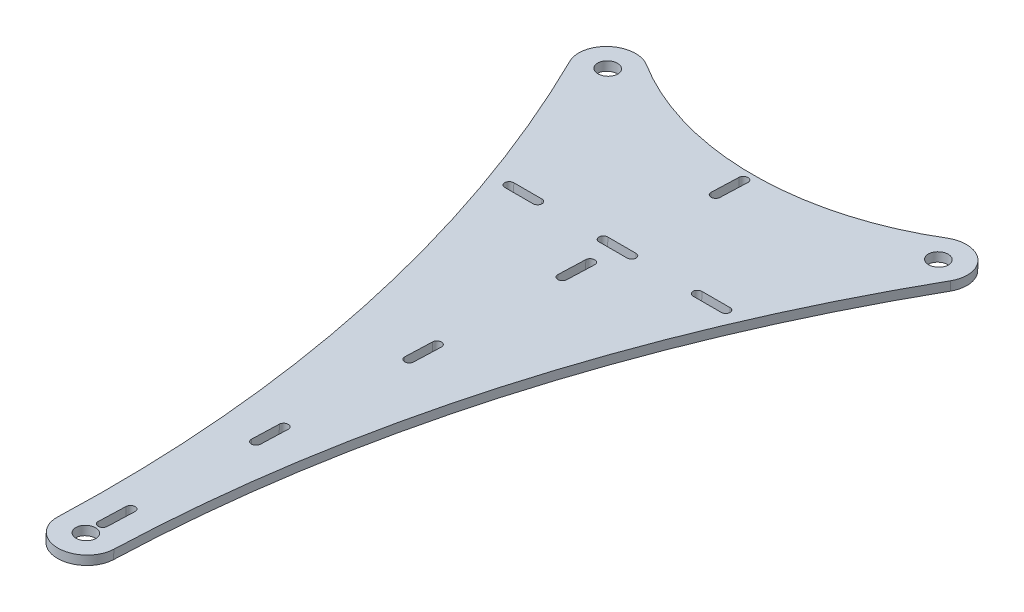
from build123d import *

# Parameters (mm, degrees)
SKETCH1_R           = 3.499999985
SKETCH1_R_2         = 3.5
BOSS_EXTRUDE1_DEPTH = 3.175
CUT_EXTRUDE1_DEPTH  = 3.175


with BuildPart() as part:
    # Sketch1 → Boss-Extrude1 (new body)
    with BuildSketch(Plane(origin=(0, 79.166310833, -2.766864901), x_dir=(0, -0.03492870325036397, -0.9993898066766781), z_dir=(0, -0.9993898066766781, 0.03492870325036397))):
        with BuildLine():
            ThreePointArc((-118.870418158, 10), (-128.870418158, 0), (-118.870418158, -10))
            ThreePointArc((-118.870418158, -10), (4.966133868, -24.680117915), (121.938173717, -67.906722838))
            ThreePointArc((121.938173717, -67.906722838), (133.880607875, -65.730494008), (134.924502551, -53.636363636))
            ThreePointArc((134.924502551, -53.636363636), (119.323202161, 0), (134.924502551, 53.636363636))
            ThreePointArc((134.924502551, 53.636363636), (133.880607875, 65.730494008), (121.938173717, 67.906722838))
            ThreePointArc((121.938173717, 67.906722838), (4.966133868, 24.680117915), (-118.870418158, 10))
        make_face()
        with Locations((-118.870418158, 0)):
            Circle(SKETCH1_R, mode=Mode.SUBTRACT)
        with Locations((126.48463259, 59)):
            Circle(SKETCH1_R_2, mode=Mode.SUBTRACT)
        with Locations((126.48463259, -59)):
            Circle(SKETCH1_R_2, mode=Mode.SUBTRACT)
    extrude(amount=BOSS_EXTRUDE1_DEPTH)

    # Sketch2 → Cut-Extrude1 (cut)
    with BuildSketch(Plane(origin=(0, 75.993248196, -2.655966268), x_dir=(1, 0, 0), z_dir=(0, -0.9993898066766781, 0.034928703250363964))):
        with BuildLine():
            Line((1.5875, 112.870418158), (1.5875, 102.870418158))
            ThreePointArc((1.5875, 102.870418158), (0, 101.282918158), (-1.5875, 102.870418158))
            Line((-1.5875, 102.870418158), (-1.5875, 112.870418158))
            ThreePointArc((-1.5875, 112.870418158), (0, 114.457918158), (1.5875, 112.870418158))
        make_face()
        with BuildLine():
            Line((1.5875, -105.938173717), (1.5875, -115.938173717))
            ThreePointArc((1.5875, -115.938173717), (0, -117.525673717), (-1.5875, -115.938173717))
            Line((-1.5875, -115.938173717), (-1.5875, -105.938173717))
            ThreePointArc((-1.5875, -105.938173717), (0, -104.350673717), (1.5875, -105.938173717))
        make_face()
        with BuildLine():
            Line((1.5875, 58.168270189), (1.5875, 48.168270189))
            ThreePointArc((1.5875, 48.168270189), (0, 46.580770189), (-1.5875, 48.168270189))
            Line((-1.5875, 48.168270189), (-1.5875, 58.168270189))
            ThreePointArc((-1.5875, 58.168270189), (0, 59.755770189), (1.5875, 58.168270189))
        make_face()
        with BuildLine():
            Line((1.5875, 3.46612222), (1.5875, -6.53387778))
            ThreePointArc((1.5875, -6.53387778), (0, -8.12137778), (-1.5875, -6.53387778))
            Line((-1.5875, -6.53387778), (-1.5875, 3.46612222))
            ThreePointArc((-1.5875, 3.46612222), (0, 5.05362222), (1.5875, 3.46612222))
        make_face()
        with BuildLine():
            Line((1.5875, -51.236025749), (1.5875, -61.236025749))
            ThreePointArc((1.5875, -61.236025749), (0, -62.823525749), (-1.5875, -61.236025749))
            Line((-1.5875, -61.236025749), (-1.5875, -51.236025749))
            ThreePointArc((-1.5875, -51.236025749), (0, -49.648525749), (1.5875, -51.236025749))
        make_face()
        with BuildLine():
            Line((38.57145678, -72.525673717), (28.57145678, -72.525673717))
            ThreePointArc((28.57145678, -72.525673717), (26.98395678, -70.938173717), (28.57145678, -69.350673717))
            Line((28.57145678, -69.350673717), (38.57145678, -69.350673717))
            ThreePointArc((38.57145678, -69.350673717), (40.15895678, -70.938173717), (38.57145678, -72.525673717))
        make_face()
        with BuildLine():
            Line((5, -72.525673717), (-5, -72.525673717))
            ThreePointArc((-5, -72.525673717), (-6.5875, -70.938173717), (-5, -69.350673717))
            Line((-5, -69.350673717), (5, -69.350673717))
            ThreePointArc((5, -69.350673717), (6.5875, -70.938173717), (5, -72.525673717))
        make_face()
        with BuildLine():
            Line((-28.57145678, -72.525673717), (-38.57145678, -72.525673717))
            ThreePointArc((-38.57145678, -72.525673717), (-40.15895678, -70.938173717), (-38.57145678, -69.350673717))
            Line((-38.57145678, -69.350673717), (-28.57145678, -69.350673717))
            ThreePointArc((-28.57145678, -69.350673717), (-26.98395678, -70.938173717), (-28.57145678, -72.525673717))
        make_face()
    extrude(amount=-CUT_EXTRUDE1_DEPTH, mode=Mode.SUBTRACT)


solid = part.part
